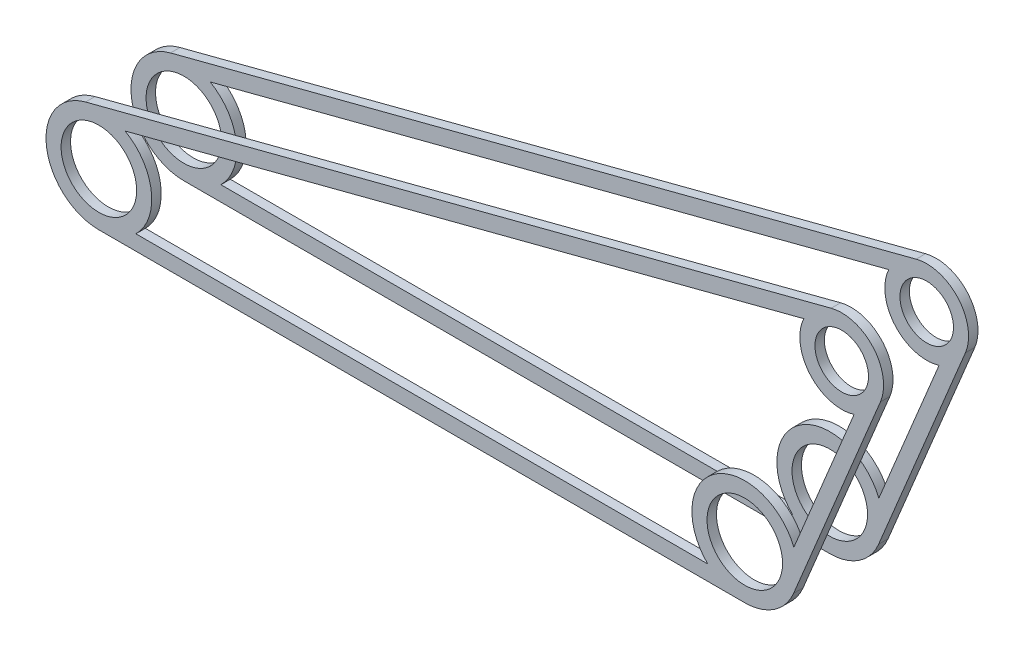
from build123d import *

# Parameters (mm, degrees)
BOSS_EXTRUDE1_START = 6.35
SKETCH1_R           = 6.35
SKETCH1_R_2         = 4.5
BOSS_EXTRUDE1_DEPTH = 1.5875
BOSS_EXTRUDE2_START = -6.35
SKETCH1_4_R         = 6.35
SKETCH1_4_R_2       = 4.5
BOSS_EXTRUDE2_DEPTH = 1.5875


with BuildPart() as part:
    # Sketch1 → Boss-Extrude1 (new body)
    with BuildSketch(Plane.XY.offset(BOSS_EXTRUDE1_START)):
        with BuildLine():
            ThreePointArc((-2.240939106, 8.602923452), (-8.817938804, -1.129626157), (0, -8.89))
            Line((0, -8.89), (108.585, -8.89))
            ThreePointArc((108.585, -8.89), (113.521814689, -7.3932375), (116.796258377, -3.406954044))
            Line((116.796258377, -3.406954044), (131.38026698, 31.742643294))
            ThreePointArc((131.38026698, 31.742643294), (130.188253202, 39.062333622), (123.103161211, 41.253277443))
            Line((123.103161211, 41.253277443), (-2.240939106, 8.602923452))
        make_face()
        Circle(SKETCH1_R, mode=Mode.SUBTRACT)
        with BuildLine():
            Line((4.420121426, 7.713275995), (118.50424059, 37.43056517))
            ThreePointArc((118.50424059, 37.43056517), (119.567273114, 29.81889368), (126.959354757, 27.715394219))
            Line((126.959354757, 27.715394219), (116.834555694, 3.31314516))
            ThreePointArc((116.834555694, 3.31314516), (103.648185311, 7.3932375), (102.363296053, -6.35))
            Line((102.363296053, -6.35), (6.221703947, -6.35))
            ThreePointArc((6.221703947, -6.35), (8.817938804, 1.129626157), (4.420121426, 7.713275995))
        make_face(mode=Mode.SUBTRACT)
        with Locations((124.877763158, 34.440613651)):
            Circle(SKETCH1_R_2, mode=Mode.SUBTRACT)
        with Locations((108.585, 0)):
            Circle(SKETCH1_R, mode=Mode.SUBTRACT)
    extrude(amount=BOSS_EXTRUDE1_DEPTH)


with BuildPart() as body_2:
    # Sketch1<4> → Boss-Extrude2 (new body)
    with BuildSketch(Plane.XY.offset(BOSS_EXTRUDE2_START)):
        with BuildLine():
            ThreePointArc((-2.240939106, 8.602923452), (-8.817938804, -1.129626157), (0, -8.89))
            Line((0, -8.89), (108.585, -8.89))
            ThreePointArc((108.585, -8.89), (113.521814689, -7.3932375), (116.796258377, -3.406954044))
            Line((116.796258377, -3.406954044), (131.38026698, 31.742643294))
            ThreePointArc((131.38026698, 31.742643294), (130.188253202, 39.062333622), (123.103161211, 41.253277443))
            Line((123.103161211, 41.253277443), (-2.240939106, 8.602923452))
        make_face()
        Circle(SKETCH1_4_R, mode=Mode.SUBTRACT)
        with BuildLine():
            Line((4.420121426, 7.713275995), (118.50424059, 37.43056517))
            ThreePointArc((118.50424059, 37.43056517), (119.567273114, 29.81889368), (126.959354757, 27.715394219))
            Line((126.959354757, 27.715394219), (116.834555694, 3.31314516))
            ThreePointArc((116.834555694, 3.31314516), (103.648185311, 7.3932375), (102.363296053, -6.35))
            Line((102.363296053, -6.35), (6.221703947, -6.35))
            ThreePointArc((6.221703947, -6.35), (8.817938804, 1.129626157), (4.420121426, 7.713275995))
        make_face(mode=Mode.SUBTRACT)
        with Locations((124.877763158, 34.440613651)):
            Circle(SKETCH1_4_R_2, mode=Mode.SUBTRACT)
        with Locations((108.585, 0)):
            Circle(SKETCH1_4_R, mode=Mode.SUBTRACT)
    extrude(amount=-BOSS_EXTRUDE2_DEPTH)


solid = Compound([part.part, body_2.part])
